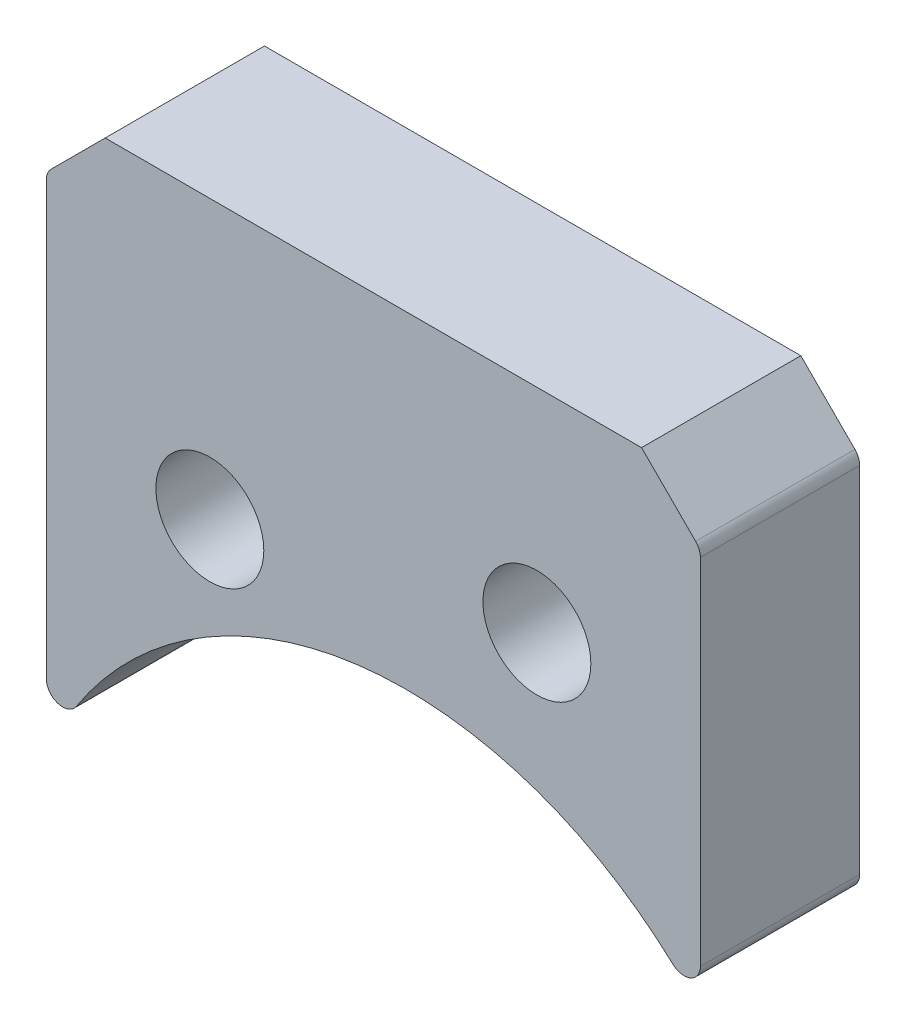
from build123d import *

# Parameters (mm, degrees)
SKETCH1_R           = 1.65
BOSS_EXTRUDE1_DEPTH = 4.87
CHAMFER1_SIZE       = 1.8
FILLET1_R           = 0.5


with BuildPart() as part:
    # Sketch1 → Boss-Extrude1 (new body)
    with BuildSketch(Plane.XY):
        with BuildLine():
            Line((-20, 0), (0, 0))
            Line((0, 0), (0, -14.062746067))
            ThreePointArc((0, -14.062746067), (-10.862024084, -10.145344108), (-20, -17.204168477))
            Line((-20, -17.204168477), (-20, 0))
        make_face()
        with Locations((-15, -8.5)):
            Circle(SKETCH1_R, mode=Mode.SUBTRACT)
        with Locations((-5, -6.5)):
            Circle(SKETCH1_R, mode=Mode.SUBTRACT)
    extrude(amount=BOSS_EXTRUDE1_DEPTH)

    # Chamfer1
    chamfer1_edges = [part.edges().sort_by_distance(p)[0] for p in [
        (0, 0, 2.435),
        (-20, 0, 2.435),
    ]]
    chamfer(chamfer1_edges, length=CHAMFER1_SIZE)

    # Fillet1
    fillet1_edges = [part.edges().sort_by_distance(p)[0] for p in [
        (-20, -1.8, 2.435),
        (0, -1.8, 2.435),
        (0, -14.062746067, 2.435),
        (-20, -17.204168477, 2.435),
    ]]
    fillet(fillet1_edges, radius=FILLET1_R)


solid = part.part
